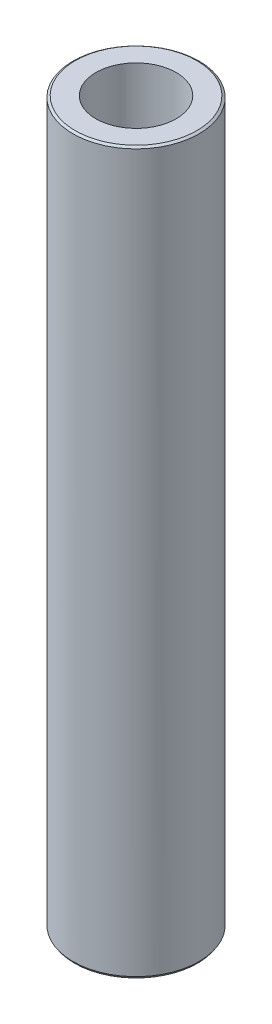
from build123d import *
from OCP.BRepFilletAPI import BRepFilletAPI_MakeChamfer

# Parameters (mm, degrees)
SKETCH1_R           = 52.5
BOSS_EXTRUDE1_DEPTH = 600
SKETCH2_R           = 33.418537963
CUT_EXTRUDE1_DEPTH  = 605.576297914
CHAMFER1_SIZE       = 1.291347105
CHAMFER1_SIZE2      = 1.930103245


with BuildPart() as part:
    # Sketch1 → Boss-Extrude1 (new body)
    with BuildSketch(Plane(origin=(0, 0, 0), x_dir=(1, 0, 0), z_dir=(0, 1, 0))):
        Circle(SKETCH1_R)
    extrude(amount=BOSS_EXTRUDE1_DEPTH)

    # Sketch2 → Cut-Extrude1 (cut, through all)
    with BuildSketch(Plane(origin=(0, 0, 0), x_dir=(1, 0, 0), z_dir=(0, 1, 0))):
        Circle(SKETCH2_R)
    extrude(amount=CUT_EXTRUDE1_DEPTH, mode=Mode.SUBTRACT)

    # Chamfer1: one chamfer whose edges measure the first distance from different faces: ONE call of the kernel's chamfer builder (chamfer() names one face for all edges)
    chamfer1_edges_1 = [part.edges().sort_by_distance(p)[0] for p in [
        (-52.5, 600, 0),
    ]]
    chamfer1_side_1 = [part.faces().sort_by_distance(p)[0] for p in [
        (-52.5, 300, 0),
    ]]
    chamfer1_edges_2 = [part.edges().sort_by_distance(p)[0] for p in [
        (-52.5, 0, 0),
    ]]
    chamfer1_side_2 = [part.faces().sort_by_distance(p)[0] for p in [
        (-51.01507576, 0, 0),
    ]]
    chamfer1 = BRepFilletAPI_MakeChamfer(part.part.solid().wrapped)
    for e in chamfer1_edges_1:
        chamfer1.Add(CHAMFER1_SIZE, CHAMFER1_SIZE2, e.wrapped, chamfer1_side_1[0].wrapped)  # the first distance lies on this face
    for e in chamfer1_edges_2:
        chamfer1.Add(CHAMFER1_SIZE, CHAMFER1_SIZE2, e.wrapped, chamfer1_side_2[0].wrapped)  # the first distance lies on this face
    add(Compound.cast(chamfer1.Shape()), mode=Mode.REPLACE)


solid = part.part
